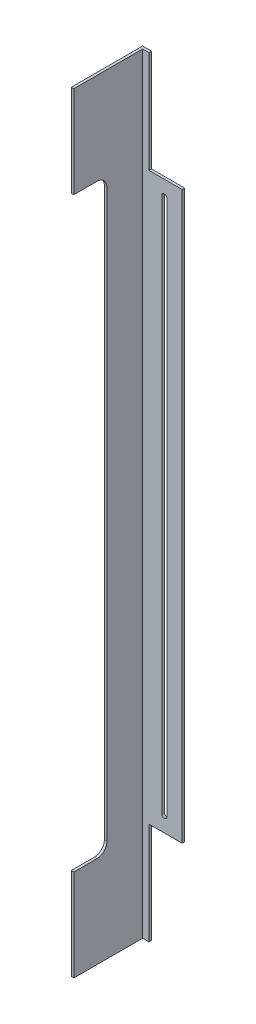
from build123d import *

# Parameters (mm, degrees)
SKETCH_1_W      = 2
SKETCH_1_H      = 212
EXTRUDE_1_DEPTH = 1
FILLET_1_R      = 1
EXTRUDE_2_DEPTH = 1
FILLET_2_R      = 4


with BuildPart() as part:
    # Эскиз1 → Бобышка-Вытянуть1 (new body)
    with BuildSketch(Plane.XY):
        Polygon((3.5, 0), (16.5, 0), (16.5, 222), (3.5, 222), (3.5, 262), (0, 262), (0, 222), (0, 0), (0, -40), (3.5, -40), align=None)
        with Locations((9.5, 111)):
            Rectangle(SKETCH_1_W, SKETCH_1_H, mode=Mode.SUBTRACT)
    extrude(amount=EXTRUDE_1_DEPTH)

    # Скругление1
    fillet_1_edges = [part.edges().sort_by_distance(p)[0] for p in [
        (8.5, 5, 0.5),
        (10.5, 5, 0.5),
        (10.5, 217, 0.5),
        (8.5, 217, 0.5),
    ]]
    fillet(fillet_1_edges, radius=FILLET_1_R - 0.0001)  # a hair under: the kernel refuses the full size

    # Эскиз2 → Бобышка-Вытянуть2 (add)
    with BuildSketch(Plane.ZY):
        Polygon((0, -40), (28, -40), (28, -4), (15, -4), (15, 226), (28, 226), (28, 262), (0, 262), align=None)
    extrude(amount=-EXTRUDE_2_DEPTH)

    # Скругление2
    fillet_2_edges = [part.edges().sort_by_distance(p)[0] for p in [
        (0.5, 226, 15),
        (0.5, -4, 15),
    ]]
    fillet(fillet_2_edges, radius=FILLET_2_R)


solid = part.part
